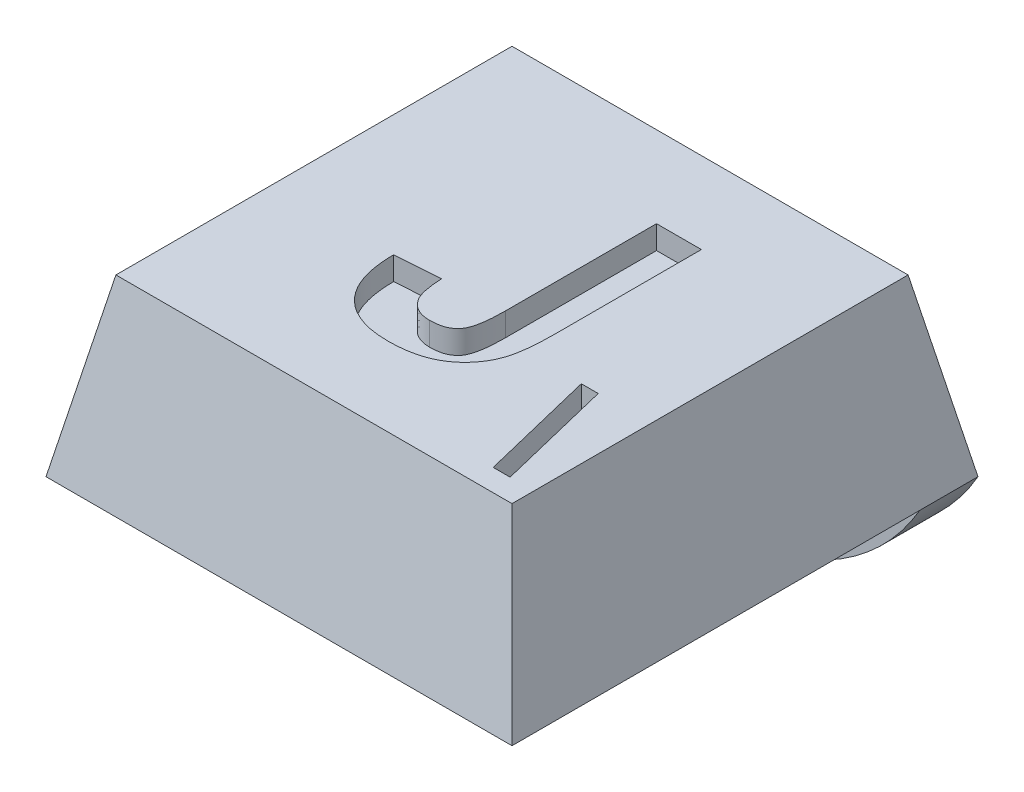
from build123d import *

# Parameters (mm, degrees)
SKETCH1_W               = 8
SKETCH1_H               = 8
BOSS_EXTRUDE1_DEPTH     = 3
CUT_EXTRUDE1_DEPTH      = 12.704699911
CUT_EXTRUDE1_DEPTH_BACK = 12.704699911
CUT_EXTRUDE2_DEPTH      = 11
SKETCH4_R               = 1.8
CUT_EXTRUDE3_DEPTH      = 0.8
SKETCH5_W               = 8
SKETCH5_H               = 1
BOSS_EXTRUDE2_DEPTH     = 2
FILLET1_R               = 4
CUT_EXTRUDE4_DEPTH      = 0.4
CUT_EXTRUDE5_DEPTH      = 0.4


with BuildPart() as part:
    # Sketch1 → Boss-Extrude1 (new body)
    with BuildSketch(Plane(origin=(0, 0, 0), x_dir=(1, 0, 0), z_dir=(0, 1, 0))):
        with Locations((4, 4)):
            Rectangle(SKETCH1_W, SKETCH1_H)
    extrude(amount=BOSS_EXTRUDE1_DEPTH)

    # Sketch2 → Cut-Extrude1 (cut, two sides: drawn at the far end of the back side and taken through both)
    with BuildSketch(Plane.XY.offset(-CUT_EXTRUDE1_DEPTH_BACK)):
        Polygon((0, 0), (0.6, 3), (0, 3), align=None)
        Polygon((8, 0), (7.4, 3), (8, 3), align=None)
    extrude(amount=CUT_EXTRUDE1_DEPTH + CUT_EXTRUDE1_DEPTH_BACK, mode=Mode.SUBTRACT)

    # Sketch3 → Cut-Extrude2 (cut)
    with BuildSketch(Plane(origin=(0, 0, 0), x_dir=(0, 0, -1), z_dir=(1, 0, 0))):
        Polygon((0, 0), (0.6, 3), (0, 3), align=None)
        Polygon((8, 3), (7.4, 3), (8, 0), align=None)
    extrude(amount=CUT_EXTRUDE2_DEPTH, mode=Mode.SUBTRACT)

    # Sketch4 → Cut-Extrude3 (cut)
    with BuildSketch(Plane.XZ):
        with Locations(Location((4, -3.75, 0), (0, 0, 270))):
            Circle(SKETCH4_R)
    extrude(amount=-CUT_EXTRUDE3_DEPTH, mode=Mode.SUBTRACT)

    # Sketch5 → Boss-Extrude2 (add)
    with BuildSketch(Plane.XZ):
        with Locations((4, -7.5)):
            Rectangle(SKETCH5_W, SKETCH5_H)
    extrude(amount=BOSS_EXTRUDE2_DEPTH)

    # Fillet1
    # the kernel refuses this fillet: 4 mm, written as the material it takes off along each edge
    with BuildSketch(Plane(origin=(8, -2, -16.660254038), x_dir=(0, 1, 0), z_dir=(0, 0, 1)), Plane(origin=(0, -2, 1.660254038), x_dir=(0, 1, 0), z_dir=(0, 0, -1))) as fillet1_piece_1:
        with BuildLine():
            CenterArc((4, 3.464101615), FILLET1_R, 180, 60)
            Line((0, 3.464101615), (-0.08, 3.464101615))
            Line((-0.08, 3.464101615), (-0.08, 0))
            Line((-0.08, 0), (0, -0.08))
            ThreePointArc((0, -0.08), (1, -0.08), (1.96, -0.069282032))
            Line((1.96, -0.069282032), (2, 0))
        make_face()
    extrude(amount=18.320508076, mode=Mode.SUBTRACT)

    # Sketch6 → Cut-Extrude4 (cut)
    with BuildSketch(Plane(origin=(0, 3, 0), x_dir=(1, 0, 0), z_dir=(0, 1, 0))):
        with BuildLine():
            Line((4.478635236, 6.002856352), (5.247866005, 6.002856352))
            Line((5.247866005, 6.002856352), (5.247866005, 3.481221736))
            add(Edge.make_bspline(
                [(5.247866005, 3.481221736), (5.247522255, 3.441153869), (5.246855206, 3.363401883), (5.242756502, 3.250390465), (5.236658321, 3.14454193), (5.227277222, 3.045871471), (5.21405872, 2.954592388), (5.200049867, 2.869976575), (5.183041427, 2.792451692), (5.167800036, 2.743951306), (5.160526262, 2.72080507)],
                knots=[0, 0, 0, 0, 1.251619961, 2.428777588, 3.532126049, 4.56323557, 5.523704531, 6.412540087, 7.242403515, 8, 8, 8, 8], degree=3))
            add(Edge.make_bspline(
                [(5.160526262, 2.72080507), (5.150361081, 2.692282601), (5.130243602, 2.635834988), (5.091141653, 2.555314881), (5.046176431, 2.479084315), (4.995474484, 2.406812938), (4.939514717, 2.338210987), (4.876399077, 2.275086649), (4.8083478, 2.215238098), (4.733446681, 2.161145289), (4.653580791, 2.110709794), (4.566475051, 2.068688963), (4.473843299, 2.032340387), (4.374908104, 2.002816628), (4.269640778, 1.979716073), (4.158311001, 1.962901894), (4.040770466, 1.95334773), (3.960490164, 1.952175274), (3.919340364, 1.9515743)],
                knots=[0, 0, 0, 0, 0.925533072, 1.831683394, 2.73255258, 3.630007683, 4.529542467, 5.436465751, 6.357118906, 7.298274949, 8.259461937, 9.242242071, 10.251058183, 11.300341426, 12.396409345, 13.544807631, 14.74152597, 16, 16, 16, 16], degree=3))
            add(Edge.make_bspline(
                [(3.919340364, 1.9515743), (3.871225528, 1.952737211), (3.777685944, 1.954998015), (3.641661475, 1.97000769), (3.514100564, 1.996260242), (3.395387048, 2.034179675), (3.284307874, 2.08131717), (3.182206561, 2.140114726), (3.088540477, 2.209392701), (3.003918711, 2.289363431), (2.928299433, 2.379218215), (2.863026475, 2.479745415), (2.80762712, 2.589893743), (2.762984692, 2.710161506), (2.727739397, 2.839972913), (2.702317462, 2.979601288), (2.687147894, 3.129126134), (2.684913172, 3.2319872), (2.683763441, 3.284907634)],
                knots=[0, 0, 0, 0, 1.114068574, 2.165849827, 3.164101702, 4.124467949, 5.046988974, 5.952942428, 6.846011651, 7.738523925, 8.642829306, 9.558838605, 10.50752403, 11.491963144, 12.524197802, 13.618364352, 14.774685164, 16, 16, 16, 16], degree=3))
            Line((2.683763441, 3.284907634), (3.45299421, 3.336189685))
            add(Edge.make_bspline(
                [(3.45299421, 3.336189685), (3.454375767, 3.307862598), (3.45702498, 3.25354382), (3.464380935, 3.175240866), (3.473682687, 3.103271277), (3.485853837, 3.037851064), (3.498960823, 2.978427444), (3.515987002, 2.926169857), (3.533886556, 2.879240769), (3.549608387, 2.851783511), (3.557160877, 2.838593531)],
                knots=[0, 0, 0, 0, 1.326609226, 2.543847584, 3.678365909, 4.719972403, 5.656527627, 6.521948534, 7.28997025, 8, 8, 8, 8], degree=3))
            add(Edge.make_bspline(
                [(3.557160877, 2.838593531), (3.56872297, 2.821148121), (3.59147861, 2.786813382), (3.632990929, 2.742071605), (3.677558537, 2.702955843), (3.727619554, 2.672203009), (3.781780527, 2.648016829), (3.840448037, 2.63044225), (3.903460331, 2.619785853), (3.946808463, 2.61876437), (3.969019851, 2.618240967)],
                knots=[0, 0, 0, 0, 1.023658308, 2.014687051, 2.979722519, 3.920049697, 4.880550909, 5.878122304, 6.912759386, 8, 8, 8, 8], degree=3))
            add(Edge.make_bspline(
                [(3.969019851, 2.618240967), (3.991477248, 2.618659453), (4.034647527, 2.619463917), (4.09686091, 2.626779219), (4.154063033, 2.638632824), (4.206285054, 2.655294856), (4.253703868, 2.676924623), (4.295268393, 2.704596166), (4.33276969, 2.735732915), (4.36516489, 2.773188264), (4.392766236, 2.818318957), (4.415812105, 2.873248962), (4.43563784, 2.938204221), (4.450960178, 3.01367855), (4.464002509, 3.098949399), (4.472183692, 3.194770716), (4.478064386, 3.300859295), (4.478439634, 3.37517575), (4.478635236, 3.413914044)],
                knots=[0, 0, 0, 0, 0.980314827, 1.884477813, 2.730827652, 3.527503874, 4.27366112, 4.998269146, 5.70163477, 6.396145331, 7.150281155, 8.001758491, 8.990432449, 10.111292654, 11.361572691, 12.75538406, 14.308707205, 16, 16, 16, 16], degree=3))
            Line((4.478635236, 3.413914044), (4.478635236, 6.002856352))
        make_face()
    extrude(amount=-CUT_EXTRUDE4_DEPTH, mode=Mode.SUBTRACT)

    # Sketch7 → Cut-Extrude5 (cut)
    with BuildSketch(Plane(origin=(0, 3, 0), x_dir=(1, 0, 0), z_dir=(0, 1, 0))):
        Polygon((6.21271865, 2.977310221), (6.502782752, 2.977310221), (6.989962239, 0.977310221), (6.700298778, 0.977310221), align=None)
    extrude(amount=-CUT_EXTRUDE5_DEPTH, mode=Mode.SUBTRACT)


solid = part.part
